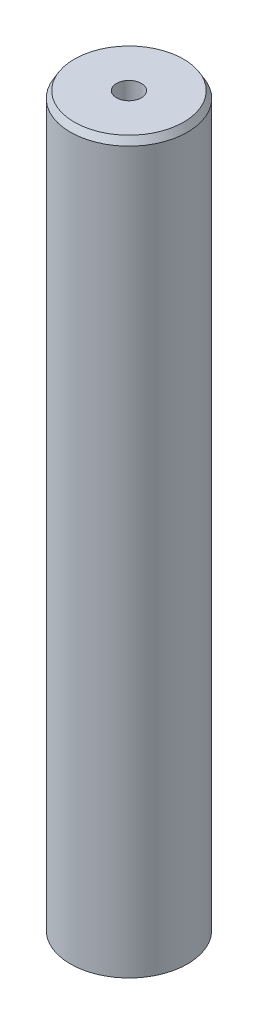
from build123d import *
from OCP.BRepFilletAPI import BRepFilletAPI_MakeChamfer

# Parameters (mm, degrees)
SKETCH1_R           = 5
BOSS_EXTRUDE1_DEPTH = 62.438615093
SKETCH2_R           = 1.065163829
CUT_EXTRUDE1_DEPTH  = 63.83773273
CHAMFER1_SIZE       = 0.576194406
CHAMFER1_SIZE2      = 0.332665995


with BuildPart() as part:
    # Sketch1 → Boss-Extrude1 (new body)
    with BuildSketch(Plane(origin=(0, 0, 0), x_dir=(1, 0, 0), z_dir=(0, 1, 0))):
        Circle(SKETCH1_R)
    extrude(amount=BOSS_EXTRUDE1_DEPTH)

    # Sketch2 → Cut-Extrude1 (cut, through all)
    with BuildSketch(Plane(origin=(0, 0, 0), x_dir=(1, 0, 0), z_dir=(0, 1, 0))):
        Circle(SKETCH2_R)
    extrude(amount=CUT_EXTRUDE1_DEPTH, mode=Mode.SUBTRACT)

    # Chamfer1: one chamfer whose edges measure the first distance from different faces: ONE call of the kernel's chamfer builder (chamfer() names one face for all edges)
    chamfer1_edges_1 = [part.edges().sort_by_distance(p)[0] for p in [
        (-5, 62.438615093, 0),
    ]]
    chamfer1_side_1 = [part.faces().sort_by_distance(p)[0] for p in [
        (-5, 31.219307546, 0),
    ]]
    chamfer1_edges_2 = [part.edges().sort_by_distance(p)[0] for p in [
        (-5, 0, 0),
    ]]
    chamfer1_side_2 = [part.faces().sort_by_distance(p)[0] for p in [
        (-4.858578644, 0, 0),
    ]]
    chamfer1 = BRepFilletAPI_MakeChamfer(part.part.solid().wrapped)
    for e in chamfer1_edges_1:
        chamfer1.Add(CHAMFER1_SIZE, CHAMFER1_SIZE2, e.wrapped, chamfer1_side_1[0].wrapped)  # the first distance lies on this face
    for e in chamfer1_edges_2:
        chamfer1.Add(CHAMFER1_SIZE, CHAMFER1_SIZE2, e.wrapped, chamfer1_side_2[0].wrapped)  # the first distance lies on this face
    add(Compound.cast(chamfer1.Shape()), mode=Mode.REPLACE)


solid = part.part
